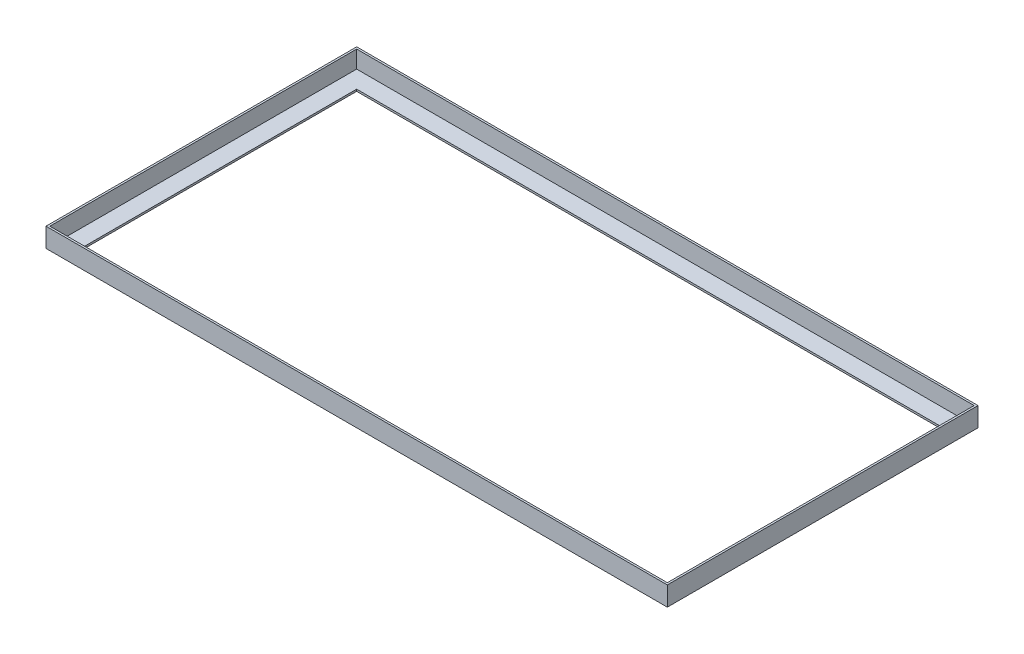
from build123d import *

# Parameters (mm, degrees)
SKETCH_1_W      = 1610
SKETCH_1_H      = 805
SKETCH_1_W_2    = 1600
SKETCH_1_H_2    = 795
EXTRUDE_1_DEPTH = 50
SKETCH_1_7_W    = 1600
SKETCH_1_7_H    = 795
SKETCH_1_7_W_2  = 1510
SKETCH_1_7_H_2  = 705
EXTRUDE_2_DEPTH = 5


with BuildPart() as part:
    # Эскиз1 → Бобышка-Вытянуть1 (new body)
    with BuildSketch(Plane(origin=(0, 0, 0), x_dir=(1, 0, 0), z_dir=(0, 1, 0))):
        with Locations((693.181818182, 324.156044294)):
            Rectangle(SKETCH_1_W, SKETCH_1_H)
        with Locations((693.181818182, 324.156044294)):
            Rectangle(SKETCH_1_W_2, SKETCH_1_H_2, mode=Mode.SUBTRACT)
    extrude(amount=EXTRUDE_1_DEPTH)

    # Эскиз1<7> → Бобышка-Вытянуть2 (add)
    with BuildSketch(Plane(origin=(0, 0, 0), x_dir=(1, 0, 0), z_dir=(0, 1, 0))):
        with Locations((693.181818182, 324.156044294)):
            Rectangle(SKETCH_1_7_W, SKETCH_1_7_H)
        with Locations((693.181818182, 324.156044294)):
            Rectangle(SKETCH_1_7_W_2, SKETCH_1_7_H_2, mode=Mode.SUBTRACT)
    extrude(amount=EXTRUDE_2_DEPTH)


solid = part.part
